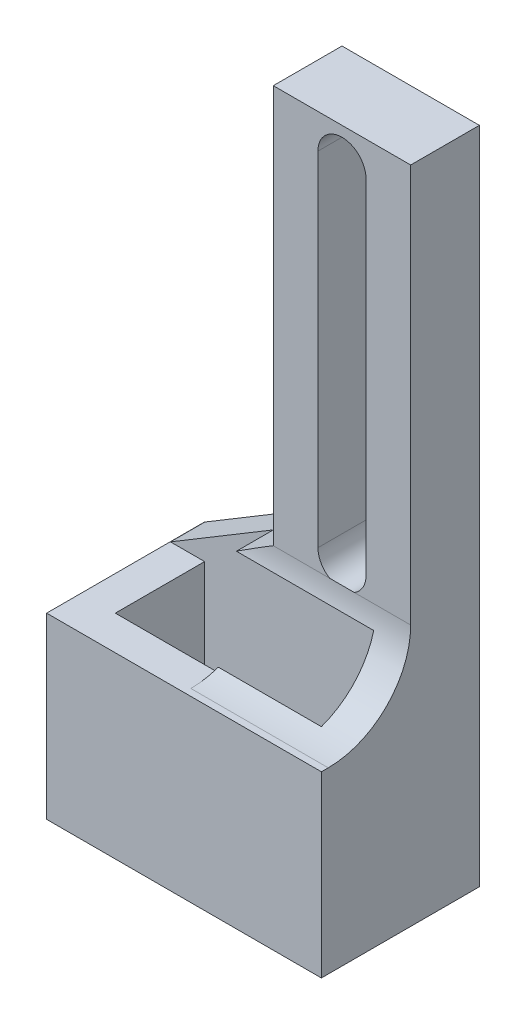
from build123d import *

# Parameters (mm, degrees)
SKETCH1_W           = 10
SKETCH1_H           = 35
BOSS_EXTRUDE1_DEPTH = 5
SKETCH9_W           = 20
SKETCH9_H           = 11.5
BOSS_EXTRUDE3_DEPTH = 13
FILLET1_R           = 6
SKETCH10_W          = 15
SKETCH10_H          = 6.5
CUT_EXTRUDE4_DEPTH  = 17.5
CUT_EXTRUDE2_DEPTH  = 10
CHAMFER2_SIZE       = 6
CHAMFER2_SIZE_2     = 9.985676894


with BuildPart() as part:
    # Sketch1 → Boss-Extrude1 (new body)
    with BuildSketch(Plane.XY):
        with Locations((5, 17.5)):
            Rectangle(SKETCH1_W, SKETCH1_H)
    extrude(amount=BOSS_EXTRUDE1_DEPTH)

    # Sketch9 → Boss-Extrude3 (add)
    with BuildSketch(Plane.XZ):
        with Locations((0, 5.75)):
            Rectangle(SKETCH9_W, SKETCH9_H)
    extrude(amount=BOSS_EXTRUDE3_DEPTH)

    # Fillet1
    fillet1_edges = [part.edges().sort_by_distance(p)[0] for p in [
        (5, 0, 5),
    ]]
    fillet(fillet1_edges, radius=FILLET1_R)

    # Sketch10 → Cut-Extrude4 (cut)
    with BuildSketch(Plane.XZ.offset(13)):
        with Locations((0, 5.75)):
            Rectangle(SKETCH10_W, SKETCH10_H)
    extrude(amount=-CUT_EXTRUDE4_DEPTH, mode=Mode.SUBTRACT)

    # Sketch4 → Cut-Extrude2 (cut)
    with BuildSketch(Plane.XY.offset(5)):
        with BuildLine():
            Line((6.75, 32.5), (6.75, 7.5))
            ThreePointArc((6.75, 7.5), (5, 5.75), (3.25, 7.5))
            Line((3.25, 7.5), (3.25, 32.5))
            ThreePointArc((3.25, 32.5), (5, 34.25), (6.75, 32.5))
        make_face()
    extrude(amount=-CUT_EXTRUDE2_DEPTH, mode=Mode.SUBTRACT)

    # Chamfer2
    # the kernel refuses this chamfer: 9.985676894, 6 mm, written as the material it adds along each edge
    with BuildSketch(Plane(origin=(0, 0, 0), x_dir=(0.055087232083824676, 0.9984815455787568, 0), z_dir=(0, 0, 1))) as chamfer2_piece_1:
        Polygon((CHAMFER2_SIZE * 0.998481545579, CHAMFER2_SIZE * 0.0550872320838), (-CHAMFER2_SIZE_2 * 0.0550872320844, CHAMFER2_SIZE_2 * 0.998481545589), (0, 0), align=None)
    extrude(amount=2.5)
    with BuildSketch(Plane(origin=(0, 0, 0), x_dir=(0.055087232083824676, 0.9984815455787568, 0), z_dir=(0, 0, 1))) as chamfer2_piece_2_section:
        Polygon((CHAMFER2_SIZE * 0.998481545579, CHAMFER2_SIZE * 0.0550872320838), (-CHAMFER2_SIZE_2 * 0.0550872320844, CHAMFER2_SIZE_2 * 0.998481545589), (0, 0), align=None)
    chamfer2_piece_2 = extrude(amount=28.325253365, mode=Mode.PRIVATE)
    chamfer2_piece_2 = chamfer2_piece_2 - Plane(origin=(-0.832139741, 6, 11), x_dir=(0, 0, -1), z_dir=(-1, 0, 0)) * Cylinder(6, 97, mode=Mode.PRIVATE)
    chamfer2_piece_2 = split(chamfer2_piece_2, bisect_by=Plane(origin=(-0.832139741, 4.5, 3.75), z_dir=(0, 1, 0)), keep=Keep.TOP, mode=Mode.PRIVATE)
    chamfer2_piece_2 = split(chamfer2_piece_2, bisect_by=Plane(origin=(-0.832139741, 5, 11.5), z_dir=(0, 0, -1)), keep=Keep.TOP, mode=Mode.PRIVATE)
    add(chamfer2_piece_2)


solid = part.part
